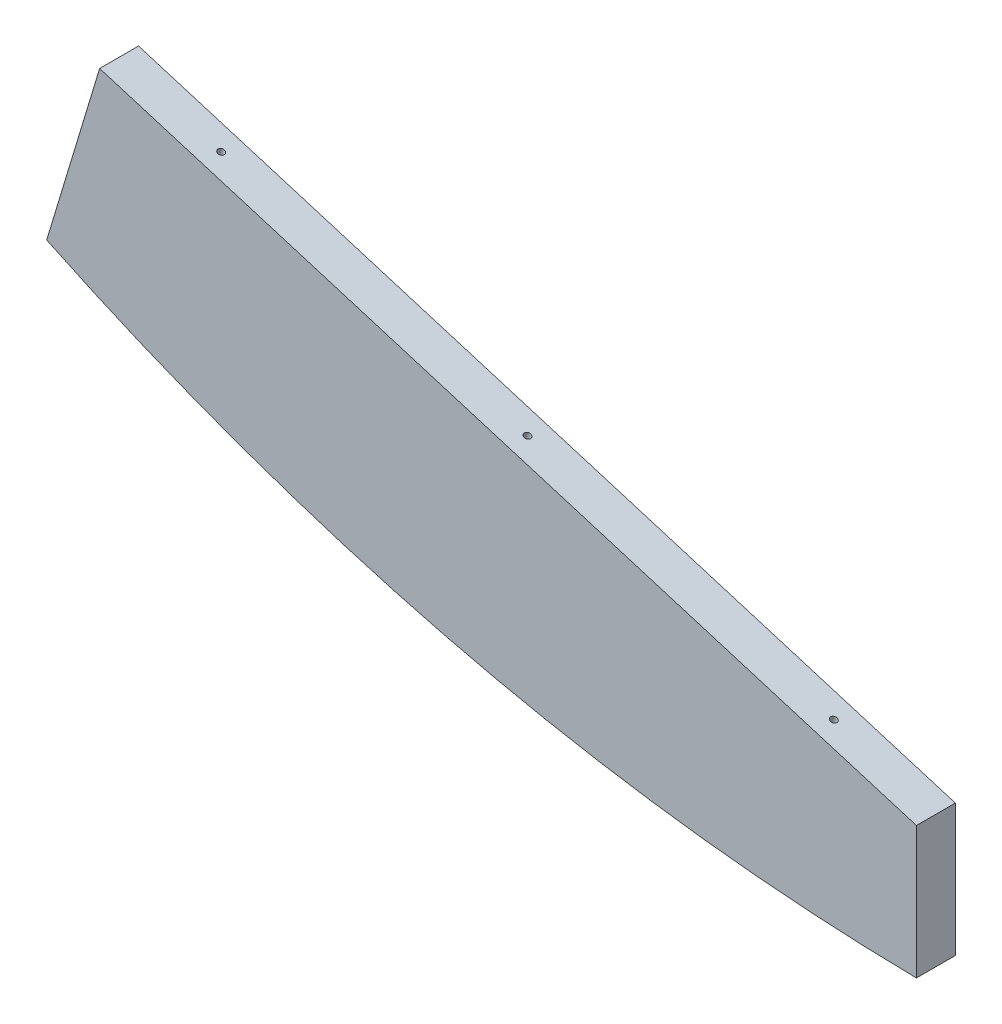
from build123d import *

# Parameters (mm, degrees)
BOSS_EXTRUDE1_DEPTH = 19.05
HOLE1_D             = 3.175
HOLE1_DEPTH         = 31.75
HOLE1_CSINK_D       = 10.16
HOLE1_CSINK_ANGLE   = 82
HOLE1_TIP           = 0.953866233
HOLE5_D             = 3.175
HOLE5_DEPTH         = 38.1
HOLE5_CSINK_D       = 10.16
HOLE5_CSINK_ANGLE   = 82
HOLE5_TIP           = 0.953866233
HOLE6_D             = 3.175
HOLE6_DEPTH         = 38.1
HOLE6_CSINK_D       = 10.16
HOLE6_CSINK_ANGLE   = 82
HOLE6_TIP           = 0.953866233


with BuildPart() as part:
    # Sketch1 → Boss-Extrude1 (new body)
    with BuildSketch(Plane.XY):
        with BuildLine():
            Line((-400.14087824, 384.351673867), (0, 263.246933614))
            Line((0, 263.246933614), (0, 198.540015411))
            ThreePointArc((0, 198.540015411), (-218.499895643, 225.348843149), (-426.096351675, 298.59247143))
            Line((-426.096351675, 298.59247143), (-400.14087824, 384.351673867))
        make_face()
    extrude(amount=-BOSS_EXTRUDE1_DEPTH)

    # Hole1
    with Locations(Plane(origin=(390.375064111, 158.3667868, -217.299999994), x_dir=(0, 0, -1), z_dir=(0.2896786029738461, 0.9571239768071433, 0))):
        with Locations((207.774999994, 613.051808534), (-207.774999994, 613.051808534), (-207.774999994, 456.277103296), (-207.774999994, 769.826513772), (-108.649999997, 456.277103296), (-108.649999997, 630.126513772), (-108.649999997, 769.826513772), (-207.774999994, 362.200879148), (-207.774999994, 305.10273792), (0, 305.10273792), (0, 362.200879148), (207.774999994, 305.10273792), (207.774999994, 362.200879148), (108.649999997, 769.826513772), (108.649999997, 630.126513772), (108.649999997, 456.277103296), (207.774999994, 769.826513772), (207.774999994, 456.277103296)):
            CounterSinkHole(HOLE1_D / 2, HOLE1_CSINK_D / 2, depth=HOLE1_DEPTH, counter_sink_angle=HOLE1_CSINK_ANGLE)
            with Locations((0, 0, -(HOLE1_DEPTH + HOLE1_TIP / 2))):  # 118° drill point
                Cone(0, HOLE1_D / 2, HOLE1_TIP, mode=Mode.SUBTRACT)

    # Hole5
    with Locations(Plane(origin=(-521.705760022, 26.532138606, -118.174999997), x_dir=(0, 0, 1), z_dir=(-0.9571239768071419, 0.2896786029738504, 0))):
        with Locations((-108.649999997, 332.89193461), (108.649999997, 332.89193461), (207.774999994, 332.89193461), (174.999999994, 448.336332751), (135.266666663, 384.042401694), (176.283333328, 384.042401694), (-174.999999994, 448.336332751), (-135.266666663, 384.042401694), (-176.283333328, 384.042401694), (-207.774999994, 332.89193461)):
            CounterSinkHole(HOLE5_D / 2, HOLE5_CSINK_D / 2, depth=HOLE5_DEPTH, counter_sink_angle=HOLE5_CSINK_ANGLE)
            with Locations((0, 0, -(HOLE5_DEPTH + HOLE5_TIP / 2))):  # 118° drill point
                Cone(0, HOLE5_D / 2, HOLE5_TIP, mode=Mode.SUBTRACT)

    # Hole6
    with Locations(Plane(origin=(-521.705760022, 26.532138606, 99.124999997), x_dir=(0, 0, 1), z_dir=(-0.9571239768071419, 0.2896786029738504, 0))):
        with Locations((-108.649999997, 332.89193461), (108.649999997, 332.89193461), (207.774999994, 332.89193461), (174.999999994, 448.336332751), (135.266666663, 384.042401694), (176.283333328, 384.042401694), (-174.999999994, 448.336332751), (-135.266666663, 384.042401694), (-176.283333328, 384.042401694), (-207.774999994, 332.89193461)):
            CounterSinkHole(HOLE6_D / 2, HOLE6_CSINK_D / 2, depth=HOLE6_DEPTH, counter_sink_angle=HOLE6_CSINK_ANGLE)
            with Locations((0, 0, -(HOLE6_DEPTH + HOLE6_TIP / 2))):  # 118° drill point
                Cone(0, HOLE6_D / 2, HOLE6_TIP, mode=Mode.SUBTRACT)


solid = part.part
